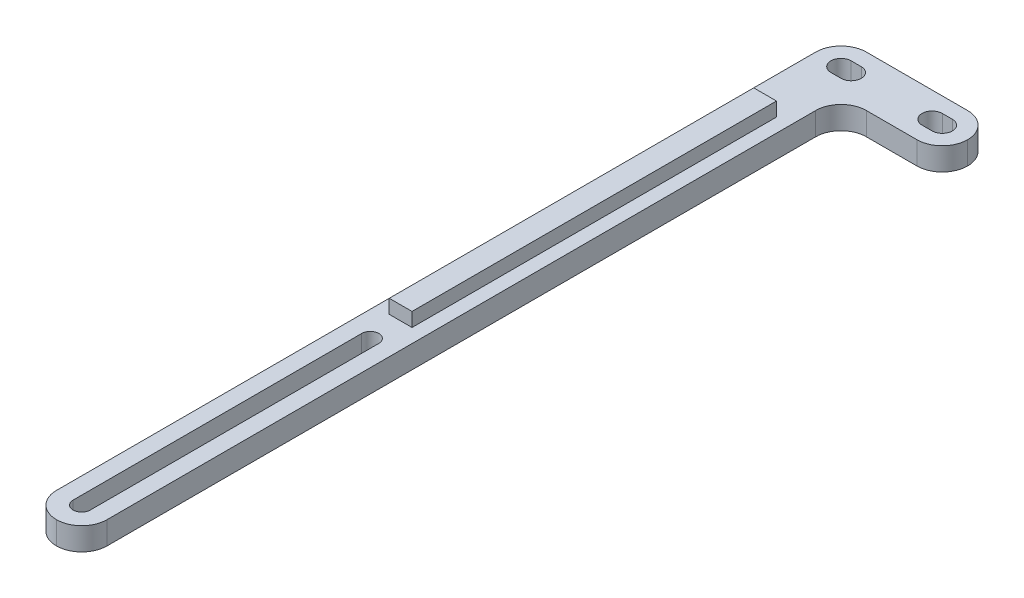
from build123d import *

# Parameters (mm, degrees)
SKETCH2_W           = 10
SKETCH2_H           = 160
BOSS_EXTRUDE1_DEPTH = 4.5
SKETCH3_W           = 10
SKETCH3_H           = 4.5
BOSS_EXTRUDE2_DEPTH = 20
FILLET1_R           = 5
FILLET2_R           = 5
FILLET3_R           = 5
CUT_EXTRUDE1_DEPTH  = 30
BOSS_EXTRUDE4_START = -20
SKETCH6_W           = 4.5
SKETCH6_H           = 10
BOSS_EXTRUDE4_DEPTH = 72


with BuildPart() as part:
    # Sketch2 → Boss-Extrude1 (new body)
    with BuildSketch(Plane(origin=(0, 0, 0), x_dir=(1, 0, 0), z_dir=(0, 1, 0))):
        with Locations((0, 93.515033533)):
            Rectangle(SKETCH2_W, SKETCH2_H)
    extrude(amount=BOSS_EXTRUDE1_DEPTH)

    # Sketch3 → Boss-Extrude2 (add)
    with BuildSketch(Plane(origin=(5, 0, 0), x_dir=(0, 0, -1), z_dir=(1, 0, 0))):
        with Locations((168.515033533, 2.25)):
            Rectangle(SKETCH3_W, SKETCH3_H)
    extrude(amount=BOSS_EXTRUDE2_DEPTH)

    # Fillet1
    fillet1_edges = [part.edges().sort_by_distance(p)[0] for p in [
        (5, 2.25, -163.515033533),
        (-5, 2.25, -173.515033533),
    ]]
    fillet(fillet1_edges, radius=FILLET1_R)

    # Fillet2
    fillet2_edges = [part.edges().sort_by_distance(p)[0] for p in [
        (-5, 2.25, -13.515033533),
        (5, 2.25, -13.515033533),
    ]]
    fillet(fillet2_edges, radius=FILLET2_R - 0.0001)  # a hair under: the kernel refuses the full size

    # Fillet3
    fillet3_edges = [part.edges().sort_by_distance(p)[0] for p in [
        (25, 2.25, -173.515033533),
        (25, 2.25, -163.515033533),
    ]]
    fillet(fillet3_edges, radius=FILLET3_R - 0.0001)  # a hair under: the kernel refuses the full size

    # Sketch4 → Cut-Extrude1 (cut)
    with BuildSketch(Plane(origin=(0, 4.5, 0), x_dir=(1, 0, 0), z_dir=(0, 1, 0))):
        with BuildLine():
            Line((-1.7, 18.515033533), (-1.7, 75.515033533))
            ThreePointArc((-1.7, 75.515033533), (0, 77.215033533), (1.7, 75.515033533))
            Line((1.7, 75.515033533), (1.7, 18.515033533))
            ThreePointArc((1.7, 18.515033533), (0, 16.815033533), (-1.7, 18.515033533))
        make_face()
        with BuildLine():
            Line((2, 166.515033533), (0, 166.515033533))
            ThreePointArc((0, 166.515033533), (-2, 168.515033533), (0, 170.515033533))
            Line((0, 170.515033533), (2, 170.515033533))
            ThreePointArc((2, 170.515033533), (4, 168.515033533), (2, 166.515033533))
        make_face()
        with BuildLine():
            Line((18, 170.515033533), (20, 170.515033533))
            ThreePointArc((20, 170.515033533), (22, 168.515033533), (20, 166.515033533))
            Line((20, 166.515033533), (18, 166.515033533))
            ThreePointArc((18, 166.515033533), (16, 168.515033533), (18, 170.515033533))
        make_face()
    extrude(amount=-CUT_EXTRUDE1_DEPTH, mode=Mode.SUBTRACT)

    # Sketch6 → Boss-Extrude4 (add)
    with BuildSketch(Plane(origin=(0, 0, -173.515033533), x_dir=(-1, 0, 0), z_dir=(0, 0, -1)).offset(BOSS_EXTRUDE4_START)):
        with Locations((0, 2.25)):
            Rectangle(SKETCH6_W, SKETCH6_H)
    extrude(amount=-BOSS_EXTRUDE4_DEPTH)


solid = part.part
